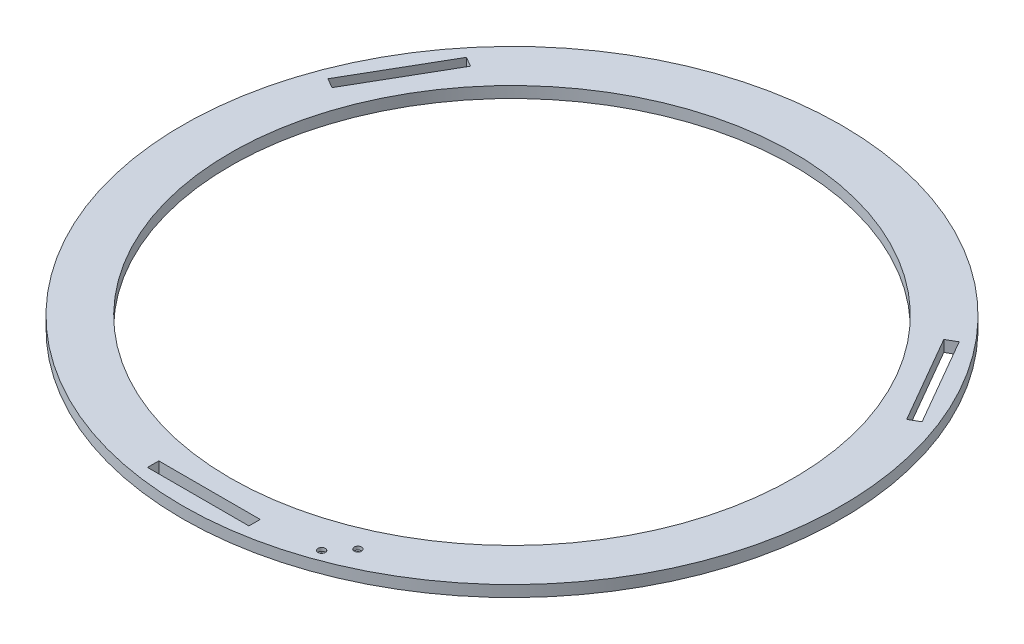
from build123d import *

# Parameters (mm, degrees)
SKETCH1_R                      = 292.5
SKETCH1_R_2                    = 250
BOSS_EXTRUDE1_DEPTH            = 10
SKETCH2_W                      = 90
SKETCH2_H                      = 10
CUT_EXTRUDE1_DEPTH             = 10
CIRPATTERN1_COUNT              = 3
CBORE_FOR_M3_SHCS1_D           = 3.4
CBORE_FOR_M3_SHCS1_CBORE_D     = 6.5
CBORE_FOR_M3_SHCS1_CBORE_DEPTH = 3


with BuildPart() as part:
    # Sketch1 → Boss-Extrude1 (new body)
    with BuildSketch(Plane(origin=(0, 0, 0), x_dir=(1, 0, 0), z_dir=(0, 1, 0))):
        Circle(SKETCH1_R)
        Circle(SKETCH1_R_2, mode=Mode.SUBTRACT)
    extrude(amount=BOSS_EXTRUDE1_DEPTH)

    # Sketch2 → Cut-Extrude1 (cut)
    with BuildSketch(Plane(origin=(0, 10, 0), x_dir=(1, 0, 0), z_dir=(0, 1, 0))):
        with Locations((0, -273.5)):
            Rectangle(SKETCH2_W, SKETCH2_H)
    cut_extrude1 = extrude(amount=-CUT_EXTRUDE1_DEPTH, mode=Mode.SUBTRACT)

    # CirPattern1: Cut-Extrude1 ×3 about axis
    cirpattern1_axis = Axis((0, 10, 0), (0, 1, 0))
    for i in range(1, CIRPATTERN1_COUNT):
        add(cut_extrude1.rotate(cirpattern1_axis, i * 360 / CIRPATTERN1_COUNT), mode=Mode.SUBTRACT)

    # CBORE for M3 SHCS1 (through all)
    with Locations(Plane(origin=(0, 10, 0), x_dir=(1, 0, 0), z_dir=(0, 1, 0))):
        with Locations((111.175516554, -247.940494387), (96.081953174, -265.03974421)):
            CounterBoreHole(CBORE_FOR_M3_SHCS1_D / 2, CBORE_FOR_M3_SHCS1_CBORE_D / 2, CBORE_FOR_M3_SHCS1_CBORE_DEPTH)


solid = part.part
